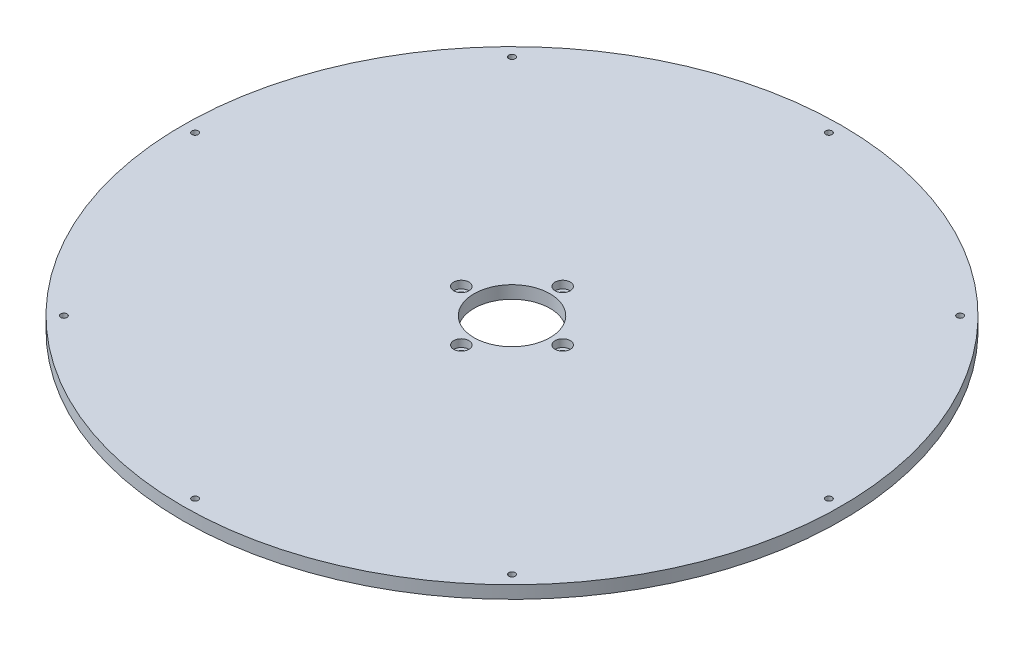
from build123d import *

# Parameters (mm, degrees)
EXTRUDE_1_OUTLINE_R   = 130
EXTRUDE_1_OUTLINE_R_2 = 1.25
EXTRUDE_1_OUTLINE_R_3 = 1.6
EXTRUDE_1_OUTLINE_R_4 = 15
EXTRUDE_1_DEPTH       = 5
SKETCH_2_R            = 3
CUT_EXTRUDE_1_DEPTH   = 3


# Read off the part's stored shape, not the designer's step: ﾎﾞｽ - 押し出し1
with BuildPart() as part:
    # ﾎﾞｽ - 押し出し1 outline → ﾎﾞｽ - 押し出し1 (new body)
    with BuildSketch(Plane(origin=(0, 0, 0), x_dir=(1, 0, 0), z_dir=(0, 1, 0))):
        Circle(EXTRUDE_1_OUTLINE_R)
        with Locations((-88.388347648, -88.388347648)):
            Circle(EXTRUDE_1_OUTLINE_R_2, mode=Mode.SUBTRACT)
        with Locations((0, -125)):
            Circle(EXTRUDE_1_OUTLINE_R_2, mode=Mode.SUBTRACT)
        with Locations((88.388347648, -88.388347648)):
            Circle(EXTRUDE_1_OUTLINE_R_2, mode=Mode.SUBTRACT)
        with Locations((0, -20)):
            Circle(EXTRUDE_1_OUTLINE_R_3, mode=Mode.SUBTRACT)
        with Locations((-125, 0)):
            Circle(EXTRUDE_1_OUTLINE_R_2, mode=Mode.SUBTRACT)
        with Locations((-20, 0)):
            Circle(EXTRUDE_1_OUTLINE_R_3, mode=Mode.SUBTRACT)
        with Locations((-88.388347648, 88.388347648)):
            Circle(EXTRUDE_1_OUTLINE_R_2, mode=Mode.SUBTRACT)
        Circle(EXTRUDE_1_OUTLINE_R_4, mode=Mode.SUBTRACT)
        with Locations((20, 0)):
            Circle(EXTRUDE_1_OUTLINE_R_3, mode=Mode.SUBTRACT)
        with Locations((0, 20)):
            Circle(EXTRUDE_1_OUTLINE_R_3, mode=Mode.SUBTRACT)
        with Locations((125, 0)):
            Circle(EXTRUDE_1_OUTLINE_R_2, mode=Mode.SUBTRACT)
        with Locations((0, 125)):
            Circle(EXTRUDE_1_OUTLINE_R_2, mode=Mode.SUBTRACT)
        with Locations((88.388347648, 88.388347648)):
            Circle(EXTRUDE_1_OUTLINE_R_2, mode=Mode.SUBTRACT)
    extrude(amount=EXTRUDE_1_DEPTH)

    # ｽｹｯﾁ2 → ｶｯﾄ - 押し出し1 (cut)
    with BuildSketch(Plane(origin=(0, 5, 0), x_dir=(1, 0, 0), z_dir=(0, 1, 0))):
        with Locations(Location((0, 20, 0), (0, 0, 270))):
            Circle(SKETCH_2_R)
        with Locations(Location((20, 0, 0), (0, 0, 270))):
            Circle(SKETCH_2_R)
        with Locations(Location((0, -20, 0), (0, 0, 270))):
            Circle(SKETCH_2_R)
        with Locations(Location((-20, 0, 0), (0, 0, 270))):
            Circle(SKETCH_2_R)
    extrude(amount=-CUT_EXTRUDE_1_DEPTH, mode=Mode.SUBTRACT)


solid = part.part
